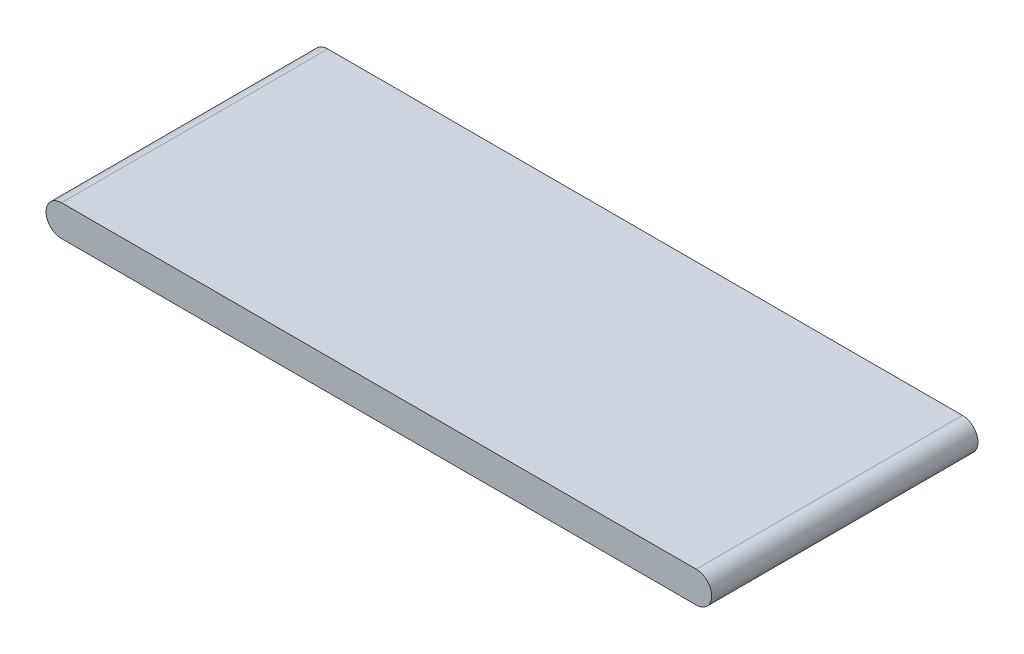
from build123d import *

# Parameters (mm, degrees)
BOSS_EXTRUDE1_DEPTH = 300


with BuildPart() as part:
    # Sketch1 → Boss-Extrude1 (new, symmetric)
    with BuildSketch(Plane.XY):
        with BuildLine():
            Line((-715, 0), (715, 0))
            ThreePointArc((715, 0), (750, -35), (715, -70))
            Line((715, -70), (-715, -70))
            ThreePointArc((-715, -70), (-750, -35), (-715, 0))
        make_face()
    extrude(amount=BOSS_EXTRUDE1_DEPTH, both=True)


solid = part.part
